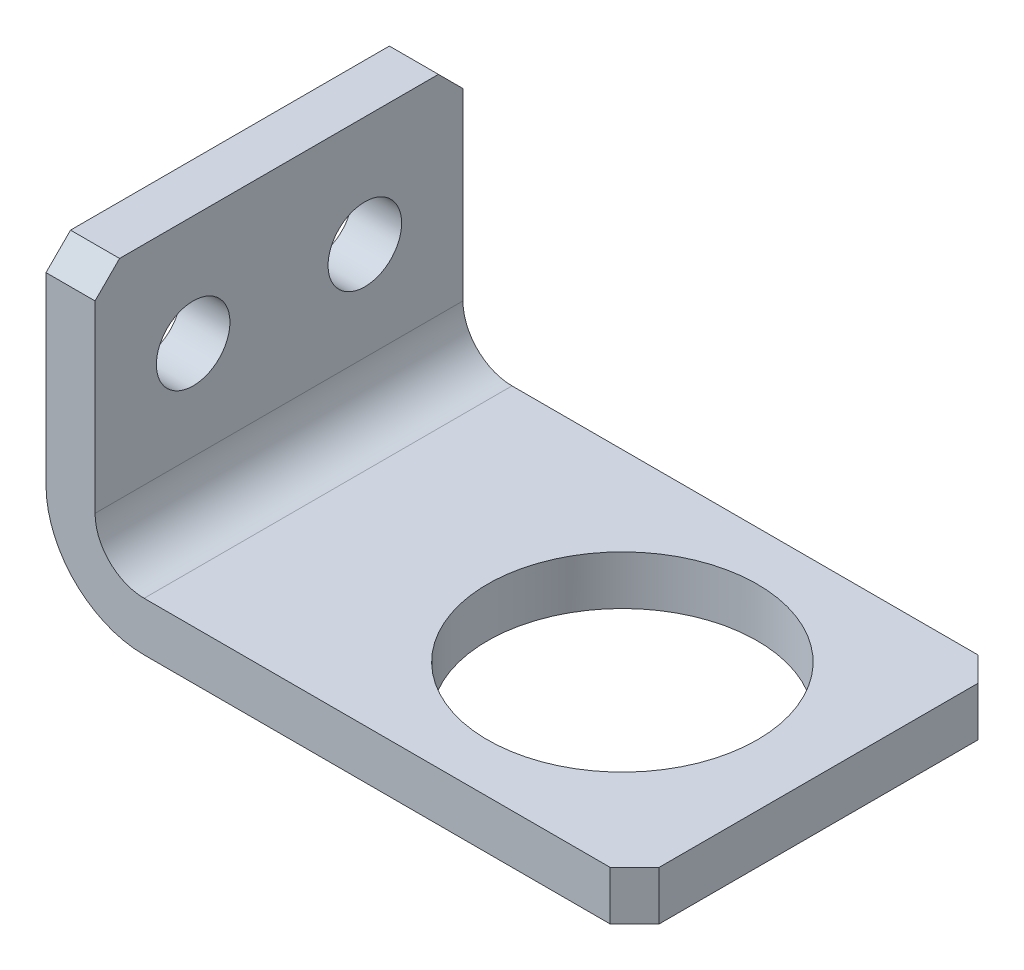
from build123d import *

# Parameters (mm, degrees)
SKETCH_1_W          = 48
SKETCH_1_H          = 30
EXTRUDE_1_DEPTH     = 25
CUT_EXTRUDE_1_DEPTH = 46.836666545
SKETCH_4_R          = 3
CUT_EXTRUDE_2_DEPTH = 38.762415177
SKETCH_5_R          = 11
CUT_EXTRUDE_4_DEPTH = 38.762415177
CHAMFER_2_SIZE      = 2
CHAMFER_3_SIZE      = 2
CHAMFER_4_SIZE      = 2
CHAMFER_5_SIZE      = 2


with BuildPart() as part:
    # 草图1 → 凸台-拉伸1 (new body)
    with BuildSketch(Plane(origin=(0, 0, 0), x_dir=(1, 0, 0), z_dir=(0, 1, 0))):
        Rectangle(SKETCH_1_W, SKETCH_1_H)
    extrude(amount=EXTRUDE_1_DEPTH)

    # 草图2 → 切除-拉伸1 (cut, through all)
    with BuildSketch(Plane.XY.offset(15)):
        with BuildLine():
            ThreePointArc((-16, 0), (-21.656854249, 2.343145751), (-24, 8))
            Line((-24, 8), (-24, 0))
            Line((-24, 0), (-16, 0))
        make_face()
        with BuildLine():
            Line((24, 25), (-20, 25))
            Line((-20, 25), (-20, 8))
            ThreePointArc((-20, 8), (-18.828427125, 5.171572875), (-16, 4))
            Line((-16, 4), (24, 4))
            Line((24, 4), (24, 25))
        make_face()
    extrude(amount=-CUT_EXTRUDE_1_DEPTH, mode=Mode.SUBTRACT)

    # 草图4 → 切除-拉伸2 (cut, through all)
    with BuildSketch(Plane(origin=(0, 0, 0), x_dir=(0, 0, -1), z_dir=(1, 0, 0))):
        with Locations((-7, 16)):
            Circle(SKETCH_4_R)
        with Locations((7, 16)):
            Circle(SKETCH_4_R)
    extrude(amount=-CUT_EXTRUDE_2_DEPTH, mode=Mode.SUBTRACT)

    # 草图5 → 切除-拉伸4 (cut, through all)
    with BuildSketch(Plane(origin=(0, 0, 0), x_dir=(1, 0, 0), z_dir=(0, 1, 0))):
        with Locations((8, 0)):
            Circle(SKETCH_5_R)
    extrude(amount=CUT_EXTRUDE_4_DEPTH, mode=Mode.SUBTRACT)

    # Chamfer 2
    chamfer_2_edges = [part.edges().sort_by_distance(p)[0] for p in [
        (24, 2, -15),
    ]]
    chamfer(chamfer_2_edges, length=CHAMFER_2_SIZE)

    # Chamfer 3
    chamfer_3_edges = [part.edges().sort_by_distance(p)[0] for p in [
        (24, 2, 15),
    ]]
    chamfer(chamfer_3_edges, length=CHAMFER_3_SIZE)

    # Chamfer 4
    chamfer_4_edges = [part.edges().sort_by_distance(p)[0] for p in [
        (-22, 25, -15),
    ]]
    chamfer(chamfer_4_edges, length=CHAMFER_4_SIZE)

    # Chamfer 5
    chamfer_5_edges = [part.edges().sort_by_distance(p)[0] for p in [
        (-22, 25, 15),
    ]]
    chamfer(chamfer_5_edges, length=CHAMFER_5_SIZE)


solid = part.part
